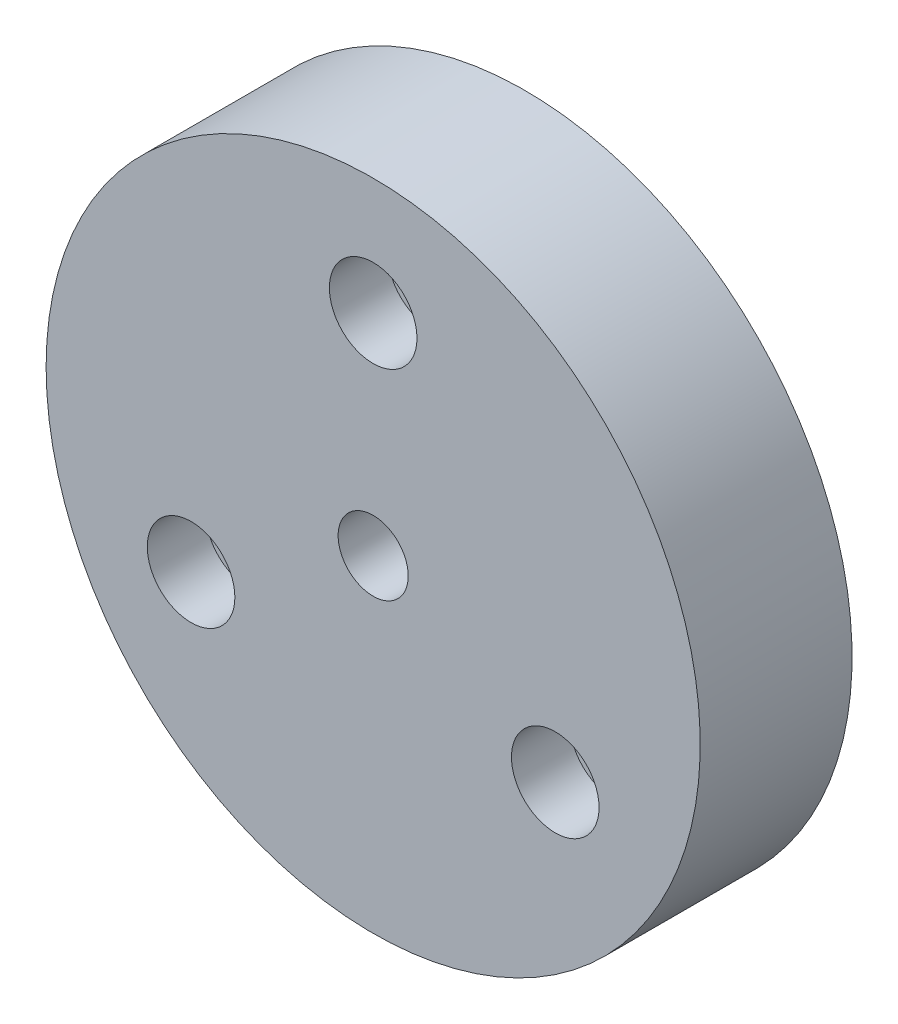
from build123d import *

# Parameters (mm, degrees)
ESQUISSE1_R             = 28
BOSS_EXTRU_1_DEPTH      = 13
ESQUISSE2_R             = 3
ENL_V_MAT_EXTRU_1_DEPTH = 42.677331968
ESQUISSE3_R             = 1.65
ENL_V_MAT_EXTRU_2_DEPTH = 42.677331968
ESQUISSE4_R             = 3.75
ENL_V_MAT_EXTRU_3_DEPTH = 5


with BuildPart() as part:
    # Esquisse1 → Boss.-Extru.1 (new body)
    with BuildSketch(Plane.XY):
        Circle(ESQUISSE1_R)
    extrude(amount=BOSS_EXTRU_1_DEPTH)

    # Esquisse2 → Enlèv. mat.-Extru.1 (cut, through all)
    with BuildSketch(Plane.XY.offset(13)):
        Circle(ESQUISSE2_R)
    extrude(amount=-ENL_V_MAT_EXTRU_1_DEPTH, mode=Mode.SUBTRACT)

    # Esquisse3 → Enlèv. mat.-Extru.2 (cut, through all)
    with BuildSketch(Plane.XY.offset(13)):
        with Locations((0, 18)):
            Circle(ESQUISSE3_R)
        with Locations((15.588457268, -9)):
            Circle(ESQUISSE3_R)
        with Locations((-15.588457268, -9)):
            Circle(ESQUISSE3_R)
    extrude(amount=-ENL_V_MAT_EXTRU_2_DEPTH, mode=Mode.SUBTRACT)

    # Esquisse4 → Enlèv. mat.-Extru.3 (cut)
    with BuildSketch(Plane.XY.offset(13)):
        with Locations((0, 18)):
            Circle(ESQUISSE4_R)
        with Locations((15.588457268, -9)):
            Circle(ESQUISSE4_R)
        with Locations((-15.588457268, -9)):
            Circle(ESQUISSE4_R)
    extrude(amount=-ENL_V_MAT_EXTRU_3_DEPTH, mode=Mode.SUBTRACT)


solid = part.part
